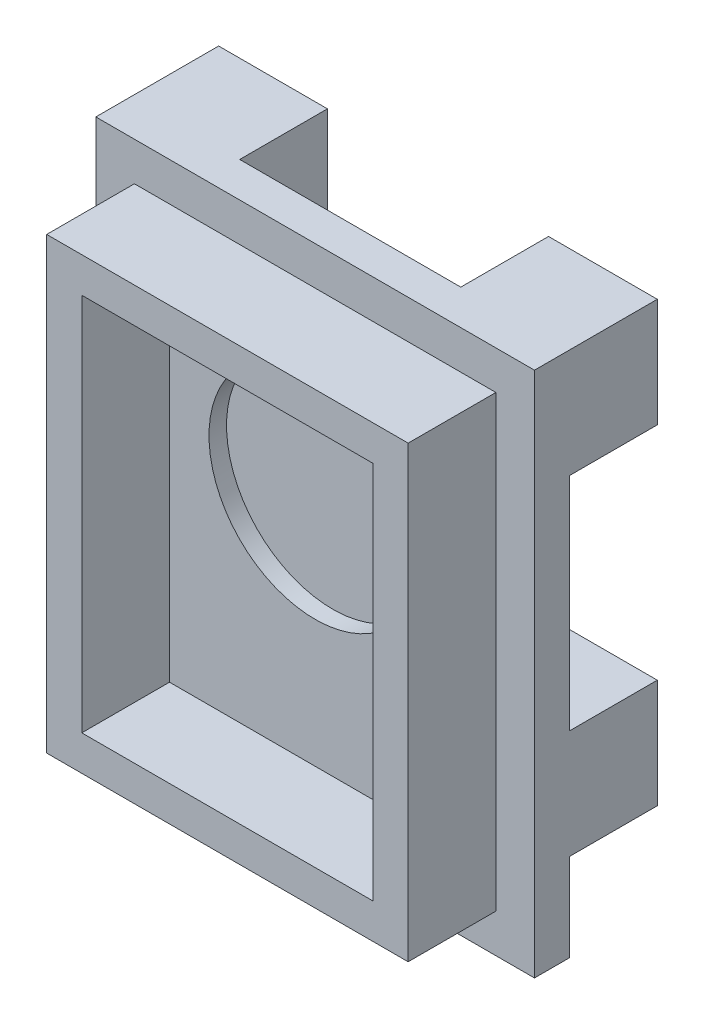
from build123d import *

# Parameters (mm, degrees)
SKETCH_1_W          = 25
SKETCH_1_H          = 30
EXTRUDE_1_DEPTH     = 2
SKETCH_2_W          = 20.6
SKETCH_2_H          = 25.6
EXTRUDE_2_DEPTH     = 5
SKETCH_3_W          = 16.6
SKETCH_3_H          = 21.6
CUT_EXTRUDE_1_DEPTH = 5
SKETCH_5_R          = 6.05
CUT_EXTRUDE_3_DEPTH = 1
SKETCH_4_W          = 6.2
SKETCH_4_H          = 6.2
EXTRUDE_4_DEPTH     = 5
SKETCH_6_R          = 1.4
CUT_EXTRUDE_5_DEPTH = 6


with BuildPart() as part:
    # ｽｹｯﾁ1 → ﾎﾞｽ - 押し出し1 (new body)
    with BuildSketch(Plane.XY):
        with Locations((-24.237274581, 24.707142857)):
            Rectangle(SKETCH_1_W, SKETCH_1_H)
    extrude(amount=EXTRUDE_1_DEPTH)

    # ｽｹｯﾁ2 → ﾎﾞｽ - 押し出し2 (add)
    with BuildSketch(Plane.XY.offset(2)):
        with Locations((-24.237274581, 24.707142857)):
            Rectangle(SKETCH_2_W, SKETCH_2_H)
    extrude(amount=EXTRUDE_2_DEPTH)

    # ｽｹｯﾁ3 → ｶｯﾄ - 押し出し1 (cut)
    with BuildSketch(Plane.XY.offset(7)):
        with Locations((-24.237274581, 24.707142857)):
            Rectangle(SKETCH_3_W, SKETCH_3_H)
    extrude(amount=-CUT_EXTRUDE_1_DEPTH, mode=Mode.SUBTRACT)

    # ｽｹｯﾁ5 → ｶｯﾄ - 押し出し3 (cut)
    with BuildSketch(Plane.XY.offset(2)):
        with Locations((-24.237274581, 27.207142857)):
            Circle(SKETCH_5_R)
    extrude(amount=-CUT_EXTRUDE_3_DEPTH, mode=Mode.SUBTRACT)

    # ｽｹｯﾁ4 → ﾎﾞｽ - 押し出し4 (add)
    with BuildSketch(Plane(origin=(0, 0, 0), x_dir=(-1, 0, 0), z_dir=(0, 0, -1))):
        with Locations((14.837274581, 36.607142857)):
            Rectangle(SKETCH_4_W, SKETCH_4_H)
        with Locations((33.637274581, 36.607142857)):
            Rectangle(SKETCH_4_W, SKETCH_4_H)
        with Locations((33.637274581, 17.807142857)):
            Rectangle(SKETCH_4_W, SKETCH_4_H)
        with Locations((14.837274581, 17.807142857)):
            Rectangle(SKETCH_4_W, SKETCH_4_H)
    extrude(amount=EXTRUDE_4_DEPTH)

    # ｽｹｯﾁ6 → ｶｯﾄ - 押し出し5 (cut)
    with BuildSketch(Plane(origin=(0, 0, -5), x_dir=(-1, 0, 0), z_dir=(0, 0, -1))):
        with Locations((14.737274581, 36.707142857)):
            Circle(SKETCH_6_R)
        with Locations((14.737274581, 17.707142857)):
            Circle(SKETCH_6_R)
        with Locations((33.737274581, 36.707142857)):
            Circle(SKETCH_6_R)
        with Locations((33.737274581, 17.707142857)):
            Circle(SKETCH_6_R)
    extrude(amount=-CUT_EXTRUDE_5_DEPTH, mode=Mode.SUBTRACT)


solid = part.part
